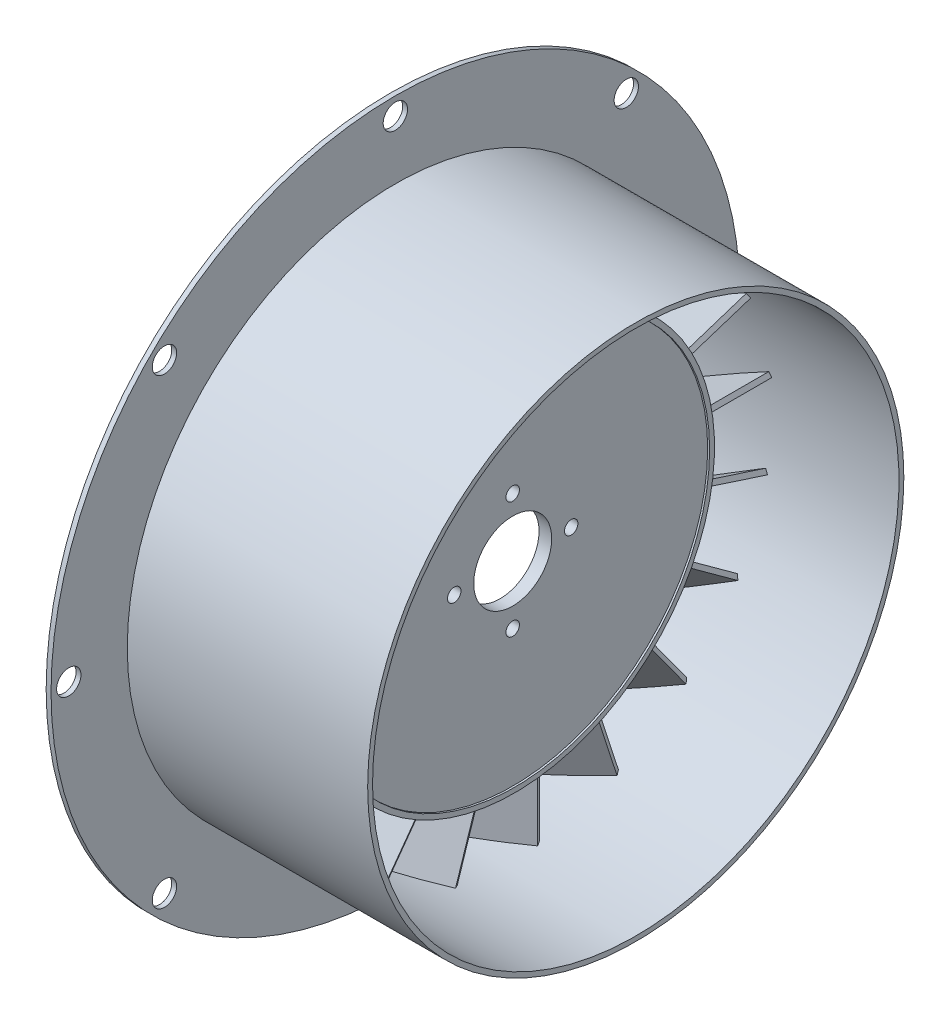
from build123d import *

# Parameters (mm, degrees)
BOSS_EXTRUDE1_REACH        = 166.235
BOSS_EXTRUDE1_START_RADIUS = 52.07
BOSS_EXTRUDE1_END_RADIUS   = 52.07
CIRPATTERN15_COUNT         = 20
SKETCH7_R                  = 1.7526
SKETCH7_R_2                = 10.16
CUT_EXTRUDE1_DEPTH         = 102.14463705
SKETCH9_R                  = 3.175
CUT_EXTRUDE2_DEPTH         = 2.54


with BuildPart() as part:
    # Sketch1 → Revolve1 (revolve)
    with BuildSketch(Plane(origin=(0, 0, 0), x_dir=(1, 0, 0), z_dir=(0, 1, 0))):
        Polygon((3.302, 0), (3.302, 50.8), (3.81, 50.8), (3.81, 52.07), (-25.4, 52.07), (-25.4, 50.8), (0, 50.8), (0, 0), align=None)
    revolve(axis=Axis((0, 0, 0), (1, 0, 0)))

    # Boss-Extrude1: from a cylinder face, 166.235 long prism both ways, kept between that surface and its translate by the depth
    boss_extrude1_start = Plane(origin=(-10.795, 0, 0), z_dir=(-1, 0, 0)) * Cylinder(BOSS_EXTRUDE1_START_RADIUS, 437.61, mode=Mode.PRIVATE)
    boss_extrude1_end = Plane(origin=(-10.795, 0, 16.51), z_dir=(-1, 0, 0)) * Cylinder(BOSS_EXTRUDE1_END_RADIUS, 437.61, mode=Mode.PRIVATE)
    # Sketch2 → Boss-Extrude1 (add, from a surface)
    with BuildSketch(Plane.XY.offset(83.82), mode=Mode.PRIVATE) as boss_extrude1_sk1:
        Polygon((-24.310727154, 7.070073869), (2.085727154, -8.169926131), (2.720727154, -7.070073869), (-23.675727154, 8.169926131), align=None)
    boss_extrude1_tool1 = extrude(boss_extrude1_sk1.sketch, amount=BOSS_EXTRUDE1_REACH, both=True, mode=Mode.PRIVATE)
    boss_extrude1 = ((boss_extrude1_tool1 - boss_extrude1_start) & boss_extrude1_end).solids().sort_by_distance((-25.4, 0, 52.07))[0]
    add(boss_extrude1)

    # CirPattern15: Boss-Extrude1 ×20 about axis
    cirpattern15_axis = Axis((3.81, 0, 0), (-1, 0, 0))
    for i in range(1, CIRPATTERN15_COUNT):
        add(boss_extrude1.rotate(cirpattern15_axis, i * 360 / CIRPATTERN15_COUNT))

    # Sketch7 → Cut-Extrude1 (cut, through all)
    with BuildSketch(Plane(origin=(3.302, 0, 0), x_dir=(0, 0, -1), z_dir=(1, 0, 0))):
        with Locations((0, 15.24)):
            Circle(SKETCH7_R)
        Circle(SKETCH7_R_2)
        with Locations((15.24, 0)):
            Circle(SKETCH7_R)
        with Locations((0, -15.24)):
            Circle(SKETCH7_R)
        with Locations((-15.24, 0)):
            Circle(SKETCH7_R)
    extrude(amount=-CUT_EXTRUDE1_DEPTH, mode=Mode.SUBTRACT)


with BuildPart() as body_2:
    # Sketch8 → Revolve2 (revolve)
    with BuildSketch(Plane.XY):
        Polygon((35.360589781, 69.85), (35.360589781, 68.58), (-28.539332901, 68.58), (-28.539332901, 89.716824123), (-27.269332901, 89.716824123), (-27.269332901, 69.85), align=None)
    revolve(axis=Axis((0, 0, 0), (1, 0, 0)))

    # Sketch9 → Cut-Extrude2 (cut)
    with BuildSketch(Plane(origin=(-27.269332901, 0, 0), x_dir=(0, 0, -1), z_dir=(1, 0, 0))):
        with Locations((0, 85.09)):
            Circle(SKETCH9_R)
        with Locations((60.167716011, 60.167716011)):
            Circle(SKETCH9_R)
        with Locations((85.09, 0)):
            Circle(SKETCH9_R)
        with Locations((60.167716011, -60.167716011)):
            Circle(SKETCH9_R)
        with Locations((0, -85.09)):
            Circle(SKETCH9_R)
        with Locations((-60.167716011, -60.167716011)):
            Circle(SKETCH9_R)
        with Locations((-85.09, 0)):
            Circle(SKETCH9_R)
        with Locations((-60.167716011, 60.167716011)):
            Circle(SKETCH9_R)
    extrude(amount=-CUT_EXTRUDE2_DEPTH, mode=Mode.SUBTRACT)


solid = Compound([part.part, body_2.part])
